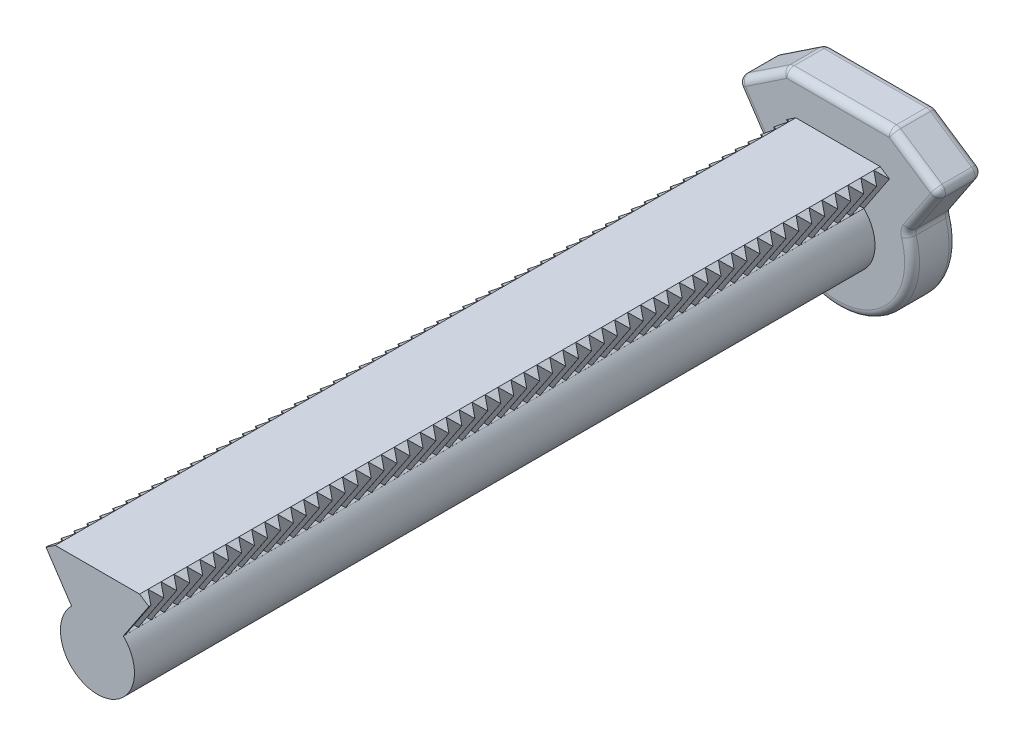
from build123d import *
from OCP.BRepFilletAPI import BRepFilletAPI_MakeChamfer

# Parameters (mm, degrees)
SALIENTE_EXTRUIR1_DEPTH = 100
CHAFL_N2_SIZE           = 1
CHAFL_N2_SIZE2          = 1.800819464
CORTAR_EXTRUIR1_DEPTH   = 6.2
MATRIZL1_COUNT          = 57
MATRIZL1_PITCH          = 1.75
SIMETR_A1_COPY_1_DEPTH  = 6.2
SIMETR_A1_COPY_2_DEPTH  = 6.2
SIMETR_A1_COPY_3_DEPTH  = 6.2
SIMETR_A1_COPY_4_DEPTH  = 6.2
SIMETR_A1_COPY_5_DEPTH  = 6.2
SIMETR_A1_COPY_6_DEPTH  = 6.2
SIMETR_A1_COPY_7_DEPTH  = 6.2
SIMETR_A1_COPY_8_DEPTH  = 6.2
SIMETR_A1_COPY_9_DEPTH  = 6.2
SIMETR_A1_COPY_10_DEPTH = 6.2
SIMETR_A1_COPY_11_DEPTH = 6.2
SIMETR_A1_COPY_12_DEPTH = 6.2
SIMETR_A1_COPY_13_DEPTH = 6.2
SIMETR_A1_COPY_14_DEPTH = 6.2
SIMETR_A1_COPY_15_DEPTH = 6.2
SIMETR_A1_COPY_16_DEPTH = 6.2
SIMETR_A1_COPY_17_DEPTH = 6.2
SIMETR_A1_COPY_18_DEPTH = 6.2
SIMETR_A1_COPY_19_DEPTH = 6.2
SIMETR_A1_COPY_20_DEPTH = 6.2
SIMETR_A1_COPY_21_DEPTH = 6.2
SIMETR_A1_COPY_22_DEPTH = 6.2
SIMETR_A1_COPY_23_DEPTH = 6.2
SIMETR_A1_COPY_24_DEPTH = 6.2
SIMETR_A1_COPY_25_DEPTH = 6.2
SIMETR_A1_COPY_26_DEPTH = 6.2
SIMETR_A1_COPY_27_DEPTH = 6.2
SIMETR_A1_COPY_28_DEPTH = 6.2
SIMETR_A1_COPY_29_DEPTH = 6.2
SIMETR_A1_COPY_30_DEPTH = 6.2
SIMETR_A1_COPY_31_DEPTH = 6.2
SIMETR_A1_COPY_32_DEPTH = 6.2
SIMETR_A1_COPY_33_DEPTH = 6.2
SIMETR_A1_COPY_34_DEPTH = 6.2
SIMETR_A1_COPY_35_DEPTH = 6.2
SIMETR_A1_COPY_36_DEPTH = 6.2
SIMETR_A1_COPY_37_DEPTH = 6.2
SIMETR_A1_COPY_38_DEPTH = 6.2
SIMETR_A1_COPY_39_DEPTH = 6.2
SIMETR_A1_COPY_40_DEPTH = 6.2
SIMETR_A1_COPY_41_DEPTH = 6.2
SIMETR_A1_COPY_42_DEPTH = 6.2
SIMETR_A1_COPY_43_DEPTH = 6.2
SIMETR_A1_COPY_44_DEPTH = 6.2
SIMETR_A1_COPY_45_DEPTH = 6.2
SIMETR_A1_COPY_46_DEPTH = 6.2
SIMETR_A1_COPY_47_DEPTH = 6.2
SIMETR_A1_COPY_48_DEPTH = 6.2
SIMETR_A1_COPY_49_DEPTH = 6.2
SIMETR_A1_COPY_50_DEPTH = 6.2
SIMETR_A1_COPY_51_DEPTH = 6.2
SIMETR_A1_COPY_52_DEPTH = 6.2
SIMETR_A1_COPY_53_DEPTH = 6.2
SIMETR_A1_COPY_54_DEPTH = 6.2
SIMETR_A1_COPY_55_DEPTH = 6.2
SIMETR_A1_COPY_56_DEPTH = 6.2
SIMETR_A1_COPY_57_DEPTH = 6.2
SALIENTE_EXTRUIR2_DEPTH = 6
REDONDEO1_R             = 1


with BuildPart() as part:
    # Croquis1 → Saliente-Extruir1 (new body)
    with BuildSketch(Plane.XY):
        with BuildLine():
            Line((-7.5, 9.576859786), (-3.493719232, 3.576859786))
            ThreePointArc((-3.493719232, 3.576859786), (0, -5), (3.493719232, 3.576859786))
            Line((3.493719232, 3.576859786), (7.5, 9.576859786))
            Line((7.5, 9.576859786), (-7.5, 9.576859786))
        make_face()
    extrude(amount=SALIENTE_EXTRUIR1_DEPTH)

    # Chaflán2: one chamfer whose edges measure the first distance from different faces: ONE call of the kernel's chamfer builder (chamfer() names one face for all edges)
    chafl_n2_edges_1 = [part.edges().sort_by_distance(p)[0] for p in [
        (-7.5, 9.576859786, 50),
    ]]
    chafl_n2_side_1 = [part.faces().sort_by_distance(p)[0] for p in [
        (-5.496859616, 6.576859786, 50),
    ]]
    chafl_n2_edges_2 = [part.edges().sort_by_distance(p)[0] for p in [
        (7.5, 9.576859786, 50),
    ]]
    chafl_n2_side_2 = [part.faces().sort_by_distance(p)[0] for p in [
        (5.496859616, 6.576859786, 50),
    ]]
    chafl_n2 = BRepFilletAPI_MakeChamfer(part.part.solid().wrapped)
    for e in chafl_n2_edges_1:
        chafl_n2.Add(CHAFL_N2_SIZE, CHAFL_N2_SIZE2, e.wrapped, chafl_n2_side_1[0].wrapped)  # the first distance lies on this face
    for e in chafl_n2_edges_2:
        chafl_n2.Add(CHAFL_N2_SIZE, CHAFL_N2_SIZE2, e.wrapped, chafl_n2_side_2[0].wrapped)  # the first distance lies on this face
    add(Compound.cast(chafl_n2.Shape()), mode=Mode.REPLACE)

    # Croquis2 → Cortar-Extruir1 (cut)
    with BuildSketch(Plane(origin=(6.180158411, 9.255704384, 0), x_dir=(0.8316482768383068, -0.555302749526666, 0), z_dir=(0.555302749526666, 0.8316482768383068, 0))):
        Polygon((0.919305505, 0), (0.919305505, -1.729335419), (-0.578342899, -0.864667709), align=None)
    cortar_extruir1 = extrude(amount=-CORTAR_EXTRUIR1_DEPTH, mode=Mode.SUBTRACT)

    # MatrizL1: Cortar-Extruir1 ×57
    with Locations(*[(0, 0, i * MATRIZL1_PITCH) for i in range(1, MATRIZL1_COUNT)]):
        add(cortar_extruir1, mode=Mode.SUBTRACT)

    # Simetría1 copy 1 sketch → Simetría1 copy 1 (cut)
    with BuildSketch(Plane(origin=(-6.180158411, 9.255704384, 1.75), x_dir=(-0.8316482768383068, -0.555302749526666, 0), z_dir=(-0.555302749526666, 0.8316482768383068, 0))):
        Polygon((0.919305505, 0), (0.919305505, 1.729335419), (-0.578342899, 0.864667709), align=None)
    extrude(amount=-SIMETR_A1_COPY_1_DEPTH, mode=Mode.SUBTRACT)

    # Simetría1 copy 2 sketch → Simetría1 copy 2 (cut)
    with BuildSketch(Plane(origin=(-6.180158411, 9.255704384, 3.5), x_dir=(-0.8316482768383068, -0.555302749526666, 0), z_dir=(-0.555302749526666, 0.8316482768383068, 0))):
        Polygon((0.919305505, 0), (0.919305505, 1.729335419), (-0.578342899, 0.864667709), align=None)
    extrude(amount=-SIMETR_A1_COPY_2_DEPTH, mode=Mode.SUBTRACT)

    # Simetría1 copy 3 sketch → Simetría1 copy 3 (cut)
    with BuildSketch(Plane(origin=(-6.180158411, 9.255704384, 5.25), x_dir=(-0.8316482768383068, -0.555302749526666, 0), z_dir=(-0.555302749526666, 0.8316482768383068, 0))):
        Polygon((0.919305505, 0), (0.919305505, 1.729335419), (-0.578342899, 0.864667709), align=None)
    extrude(amount=-SIMETR_A1_COPY_3_DEPTH, mode=Mode.SUBTRACT)

    # Simetría1 copy 4 sketch → Simetría1 copy 4 (cut)
    with BuildSketch(Plane(origin=(-6.180158411, 9.255704384, 7), x_dir=(-0.8316482768383068, -0.555302749526666, 0), z_dir=(-0.555302749526666, 0.8316482768383068, 0))):
        Polygon((0.919305505, 0), (0.919305505, 1.729335419), (-0.578342899, 0.864667709), align=None)
    extrude(amount=-SIMETR_A1_COPY_4_DEPTH, mode=Mode.SUBTRACT)

    # Simetría1 copy 5 sketch → Simetría1 copy 5 (cut)
    with BuildSketch(Plane(origin=(-6.180158411, 9.255704384, 8.75), x_dir=(-0.8316482768383068, -0.555302749526666, 0), z_dir=(-0.555302749526666, 0.8316482768383068, 0))):
        Polygon((0.919305505, 0), (0.919305505, 1.729335419), (-0.578342899, 0.864667709), align=None)
    extrude(amount=-SIMETR_A1_COPY_5_DEPTH, mode=Mode.SUBTRACT)

    # Simetría1 copy 6 sketch → Simetría1 copy 6 (cut)
    with BuildSketch(Plane(origin=(-6.180158411, 9.255704384, 10.5), x_dir=(-0.8316482768383068, -0.555302749526666, 0), z_dir=(-0.555302749526666, 0.8316482768383068, 0))):
        Polygon((0.919305505, 0), (0.919305505, 1.729335419), (-0.578342899, 0.864667709), align=None)
    extrude(amount=-SIMETR_A1_COPY_6_DEPTH, mode=Mode.SUBTRACT)

    # Simetría1 copy 7 sketch → Simetría1 copy 7 (cut)
    with BuildSketch(Plane(origin=(-6.180158411, 9.255704384, 12.25), x_dir=(-0.8316482768383068, -0.555302749526666, 0), z_dir=(-0.555302749526666, 0.8316482768383068, 0))):
        Polygon((0.919305505, 0), (0.919305505, 1.729335419), (-0.578342899, 0.864667709), align=None)
    extrude(amount=-SIMETR_A1_COPY_7_DEPTH, mode=Mode.SUBTRACT)

    # Simetría1 copy 8 sketch → Simetría1 copy 8 (cut)
    with BuildSketch(Plane(origin=(-6.180158411, 9.255704384, 14), x_dir=(-0.8316482768383068, -0.555302749526666, 0), z_dir=(-0.555302749526666, 0.8316482768383068, 0))):
        Polygon((0.919305505, 0), (0.919305505, 1.729335419), (-0.578342899, 0.864667709), align=None)
    extrude(amount=-SIMETR_A1_COPY_8_DEPTH, mode=Mode.SUBTRACT)

    # Simetría1 copy 9 sketch → Simetría1 copy 9 (cut)
    with BuildSketch(Plane(origin=(-6.180158411, 9.255704384, 15.75), x_dir=(-0.8316482768383068, -0.555302749526666, 0), z_dir=(-0.555302749526666, 0.8316482768383068, 0))):
        Polygon((0.919305505, 0), (0.919305505, 1.729335419), (-0.578342899, 0.864667709), align=None)
    extrude(amount=-SIMETR_A1_COPY_9_DEPTH, mode=Mode.SUBTRACT)

    # Simetría1 copy 10 sketch → Simetría1 copy 10 (cut)
    with BuildSketch(Plane(origin=(-6.180158411, 9.255704384, 17.5), x_dir=(-0.8316482768383068, -0.555302749526666, 0), z_dir=(-0.555302749526666, 0.8316482768383068, 0))):
        Polygon((0.919305505, 0), (0.919305505, 1.729335419), (-0.578342899, 0.864667709), align=None)
    extrude(amount=-SIMETR_A1_COPY_10_DEPTH, mode=Mode.SUBTRACT)

    # Simetría1 copy 11 sketch → Simetría1 copy 11 (cut)
    with BuildSketch(Plane(origin=(-6.180158411, 9.255704384, 19.25), x_dir=(-0.8316482768383068, -0.555302749526666, 0), z_dir=(-0.555302749526666, 0.8316482768383068, 0))):
        Polygon((0.919305505, 0), (0.919305505, 1.729335419), (-0.578342899, 0.864667709), align=None)
    extrude(amount=-SIMETR_A1_COPY_11_DEPTH, mode=Mode.SUBTRACT)

    # Simetría1 copy 12 sketch → Simetría1 copy 12 (cut)
    with BuildSketch(Plane(origin=(-6.180158411, 9.255704384, 21), x_dir=(-0.8316482768383068, -0.555302749526666, 0), z_dir=(-0.555302749526666, 0.8316482768383068, 0))):
        Polygon((0.919305505, 0), (0.919305505, 1.729335419), (-0.578342899, 0.864667709), align=None)
    extrude(amount=-SIMETR_A1_COPY_12_DEPTH, mode=Mode.SUBTRACT)

    # Simetría1 copy 13 sketch → Simetría1 copy 13 (cut)
    with BuildSketch(Plane(origin=(-6.180158411, 9.255704384, 22.75), x_dir=(-0.8316482768383068, -0.555302749526666, 0), z_dir=(-0.555302749526666, 0.8316482768383068, 0))):
        Polygon((0.919305505, 0), (0.919305505, 1.729335419), (-0.578342899, 0.864667709), align=None)
    extrude(amount=-SIMETR_A1_COPY_13_DEPTH, mode=Mode.SUBTRACT)

    # Simetría1 copy 14 sketch → Simetría1 copy 14 (cut)
    with BuildSketch(Plane(origin=(-6.180158411, 9.255704384, 24.5), x_dir=(-0.8316482768383068, -0.555302749526666, 0), z_dir=(-0.555302749526666, 0.8316482768383068, 0))):
        Polygon((0.919305505, 0), (0.919305505, 1.729335419), (-0.578342899, 0.864667709), align=None)
    extrude(amount=-SIMETR_A1_COPY_14_DEPTH, mode=Mode.SUBTRACT)

    # Simetría1 copy 15 sketch → Simetría1 copy 15 (cut)
    with BuildSketch(Plane(origin=(-6.180158411, 9.255704384, 26.25), x_dir=(-0.8316482768383068, -0.555302749526666, 0), z_dir=(-0.555302749526666, 0.8316482768383068, 0))):
        Polygon((0.919305505, 0), (0.919305505, 1.729335419), (-0.578342899, 0.864667709), align=None)
    extrude(amount=-SIMETR_A1_COPY_15_DEPTH, mode=Mode.SUBTRACT)

    # Simetría1 copy 16 sketch → Simetría1 copy 16 (cut)
    with BuildSketch(Plane(origin=(-6.180158411, 9.255704384, 28), x_dir=(-0.8316482768383068, -0.555302749526666, 0), z_dir=(-0.555302749526666, 0.8316482768383068, 0))):
        Polygon((0.919305505, 0), (0.919305505, 1.729335419), (-0.578342899, 0.864667709), align=None)
    extrude(amount=-SIMETR_A1_COPY_16_DEPTH, mode=Mode.SUBTRACT)

    # Simetría1 copy 17 sketch → Simetría1 copy 17 (cut)
    with BuildSketch(Plane(origin=(-6.180158411, 9.255704384, 29.75), x_dir=(-0.8316482768383068, -0.555302749526666, 0), z_dir=(-0.555302749526666, 0.8316482768383068, 0))):
        Polygon((0.919305505, 0), (0.919305505, 1.729335419), (-0.578342899, 0.864667709), align=None)
    extrude(amount=-SIMETR_A1_COPY_17_DEPTH, mode=Mode.SUBTRACT)

    # Simetría1 copy 18 sketch → Simetría1 copy 18 (cut)
    with BuildSketch(Plane(origin=(-6.180158411, 9.255704384, 31.5), x_dir=(-0.8316482768383068, -0.555302749526666, 0), z_dir=(-0.555302749526666, 0.8316482768383068, 0))):
        Polygon((0.919305505, 0), (0.919305505, 1.729335419), (-0.578342899, 0.864667709), align=None)
    extrude(amount=-SIMETR_A1_COPY_18_DEPTH, mode=Mode.SUBTRACT)

    # Simetría1 copy 19 sketch → Simetría1 copy 19 (cut)
    with BuildSketch(Plane(origin=(-6.180158411, 9.255704384, 33.25), x_dir=(-0.8316482768383068, -0.555302749526666, 0), z_dir=(-0.555302749526666, 0.8316482768383068, 0))):
        Polygon((0.919305505, 0), (0.919305505, 1.729335419), (-0.578342899, 0.864667709), align=None)
    extrude(amount=-SIMETR_A1_COPY_19_DEPTH, mode=Mode.SUBTRACT)

    # Simetría1 copy 20 sketch → Simetría1 copy 20 (cut)
    with BuildSketch(Plane(origin=(-6.180158411, 9.255704384, 35), x_dir=(-0.8316482768383068, -0.555302749526666, 0), z_dir=(-0.555302749526666, 0.8316482768383068, 0))):
        Polygon((0.919305505, 0), (0.919305505, 1.729335419), (-0.578342899, 0.864667709), align=None)
    extrude(amount=-SIMETR_A1_COPY_20_DEPTH, mode=Mode.SUBTRACT)

    # Simetría1 copy 21 sketch → Simetría1 copy 21 (cut)
    with BuildSketch(Plane(origin=(-6.180158411, 9.255704384, 36.75), x_dir=(-0.8316482768383068, -0.555302749526666, 0), z_dir=(-0.555302749526666, 0.8316482768383068, 0))):
        Polygon((0.919305505, 0), (0.919305505, 1.729335419), (-0.578342899, 0.864667709), align=None)
    extrude(amount=-SIMETR_A1_COPY_21_DEPTH, mode=Mode.SUBTRACT)

    # Simetría1 copy 22 sketch → Simetría1 copy 22 (cut)
    with BuildSketch(Plane(origin=(-6.180158411, 9.255704384, 38.5), x_dir=(-0.8316482768383068, -0.555302749526666, 0), z_dir=(-0.555302749526666, 0.8316482768383068, 0))):
        Polygon((0.919305505, 0), (0.919305505, 1.729335419), (-0.578342899, 0.864667709), align=None)
    extrude(amount=-SIMETR_A1_COPY_22_DEPTH, mode=Mode.SUBTRACT)

    # Simetría1 copy 23 sketch → Simetría1 copy 23 (cut)
    with BuildSketch(Plane(origin=(-6.180158411, 9.255704384, 40.25), x_dir=(-0.8316482768383068, -0.555302749526666, 0), z_dir=(-0.555302749526666, 0.8316482768383068, 0))):
        Polygon((0.919305505, 0), (0.919305505, 1.729335419), (-0.578342899, 0.864667709), align=None)
    extrude(amount=-SIMETR_A1_COPY_23_DEPTH, mode=Mode.SUBTRACT)

    # Simetría1 copy 24 sketch → Simetría1 copy 24 (cut)
    with BuildSketch(Plane(origin=(-6.180158411, 9.255704384, 42), x_dir=(-0.8316482768383068, -0.555302749526666, 0), z_dir=(-0.555302749526666, 0.8316482768383068, 0))):
        Polygon((0.919305505, 0), (0.919305505, 1.729335419), (-0.578342899, 0.864667709), align=None)
    extrude(amount=-SIMETR_A1_COPY_24_DEPTH, mode=Mode.SUBTRACT)

    # Simetría1 copy 25 sketch → Simetría1 copy 25 (cut)
    with BuildSketch(Plane(origin=(-6.180158411, 9.255704384, 43.75), x_dir=(-0.8316482768383068, -0.555302749526666, 0), z_dir=(-0.555302749526666, 0.8316482768383068, 0))):
        Polygon((0.919305505, 0), (0.919305505, 1.729335419), (-0.578342899, 0.864667709), align=None)
    extrude(amount=-SIMETR_A1_COPY_25_DEPTH, mode=Mode.SUBTRACT)

    # Simetría1 copy 26 sketch → Simetría1 copy 26 (cut)
    with BuildSketch(Plane(origin=(-6.180158411, 9.255704384, 45.5), x_dir=(-0.8316482768383068, -0.555302749526666, 0), z_dir=(-0.555302749526666, 0.8316482768383068, 0))):
        Polygon((0.919305505, 0), (0.919305505, 1.729335419), (-0.578342899, 0.864667709), align=None)
    extrude(amount=-SIMETR_A1_COPY_26_DEPTH, mode=Mode.SUBTRACT)

    # Simetría1 copy 27 sketch → Simetría1 copy 27 (cut)
    with BuildSketch(Plane(origin=(-6.180158411, 9.255704384, 47.25), x_dir=(-0.8316482768383068, -0.555302749526666, 0), z_dir=(-0.555302749526666, 0.8316482768383068, 0))):
        Polygon((0.919305505, 0), (0.919305505, 1.729335419), (-0.578342899, 0.864667709), align=None)
    extrude(amount=-SIMETR_A1_COPY_27_DEPTH, mode=Mode.SUBTRACT)

    # Simetría1 copy 28 sketch → Simetría1 copy 28 (cut)
    with BuildSketch(Plane(origin=(-6.180158411, 9.255704384, 49), x_dir=(-0.8316482768383068, -0.555302749526666, 0), z_dir=(-0.555302749526666, 0.8316482768383068, 0))):
        Polygon((0.919305505, 0), (0.919305505, 1.729335419), (-0.578342899, 0.864667709), align=None)
    extrude(amount=-SIMETR_A1_COPY_28_DEPTH, mode=Mode.SUBTRACT)

    # Simetría1 copy 29 sketch → Simetría1 copy 29 (cut)
    with BuildSketch(Plane(origin=(-6.180158411, 9.255704384, 50.75), x_dir=(-0.8316482768383068, -0.555302749526666, 0), z_dir=(-0.555302749526666, 0.8316482768383068, 0))):
        Polygon((0.919305505, 0), (0.919305505, 1.729335419), (-0.578342899, 0.864667709), align=None)
    extrude(amount=-SIMETR_A1_COPY_29_DEPTH, mode=Mode.SUBTRACT)

    # Simetría1 copy 30 sketch → Simetría1 copy 30 (cut)
    with BuildSketch(Plane(origin=(-6.180158411, 9.255704384, 52.5), x_dir=(-0.8316482768383068, -0.555302749526666, 0), z_dir=(-0.555302749526666, 0.8316482768383068, 0))):
        Polygon((0.919305505, 0), (0.919305505, 1.729335419), (-0.578342899, 0.864667709), align=None)
    extrude(amount=-SIMETR_A1_COPY_30_DEPTH, mode=Mode.SUBTRACT)

    # Simetría1 copy 31 sketch → Simetría1 copy 31 (cut)
    with BuildSketch(Plane(origin=(-6.180158411, 9.255704384, 54.25), x_dir=(-0.8316482768383068, -0.555302749526666, 0), z_dir=(-0.555302749526666, 0.8316482768383068, 0))):
        Polygon((0.919305505, 0), (0.919305505, 1.729335419), (-0.578342899, 0.864667709), align=None)
    extrude(amount=-SIMETR_A1_COPY_31_DEPTH, mode=Mode.SUBTRACT)

    # Simetría1 copy 32 sketch → Simetría1 copy 32 (cut)
    with BuildSketch(Plane(origin=(-6.180158411, 9.255704384, 56), x_dir=(-0.8316482768383068, -0.555302749526666, 0), z_dir=(-0.555302749526666, 0.8316482768383068, 0))):
        Polygon((0.919305505, 0), (0.919305505, 1.729335419), (-0.578342899, 0.864667709), align=None)
    extrude(amount=-SIMETR_A1_COPY_32_DEPTH, mode=Mode.SUBTRACT)

    # Simetría1 copy 33 sketch → Simetría1 copy 33 (cut)
    with BuildSketch(Plane(origin=(-6.180158411, 9.255704384, 57.75), x_dir=(-0.8316482768383068, -0.555302749526666, 0), z_dir=(-0.555302749526666, 0.8316482768383068, 0))):
        Polygon((0.919305505, 0), (0.919305505, 1.729335419), (-0.578342899, 0.864667709), align=None)
    extrude(amount=-SIMETR_A1_COPY_33_DEPTH, mode=Mode.SUBTRACT)

    # Simetría1 copy 34 sketch → Simetría1 copy 34 (cut)
    with BuildSketch(Plane(origin=(-6.180158411, 9.255704384, 59.5), x_dir=(-0.8316482768383068, -0.555302749526666, 0), z_dir=(-0.555302749526666, 0.8316482768383068, 0))):
        Polygon((0.919305505, 0), (0.919305505, 1.729335419), (-0.578342899, 0.864667709), align=None)
    extrude(amount=-SIMETR_A1_COPY_34_DEPTH, mode=Mode.SUBTRACT)

    # Simetría1 copy 35 sketch → Simetría1 copy 35 (cut)
    with BuildSketch(Plane(origin=(-6.180158411, 9.255704384, 61.25), x_dir=(-0.8316482768383068, -0.555302749526666, 0), z_dir=(-0.555302749526666, 0.8316482768383068, 0))):
        Polygon((0.919305505, 0), (0.919305505, 1.729335419), (-0.578342899, 0.864667709), align=None)
    extrude(amount=-SIMETR_A1_COPY_35_DEPTH, mode=Mode.SUBTRACT)

    # Simetría1 copy 36 sketch → Simetría1 copy 36 (cut)
    with BuildSketch(Plane(origin=(-6.180158411, 9.255704384, 63), x_dir=(-0.8316482768383068, -0.555302749526666, 0), z_dir=(-0.555302749526666, 0.8316482768383068, 0))):
        Polygon((0.919305505, 0), (0.919305505, 1.729335419), (-0.578342899, 0.864667709), align=None)
    extrude(amount=-SIMETR_A1_COPY_36_DEPTH, mode=Mode.SUBTRACT)

    # Simetría1 copy 37 sketch → Simetría1 copy 37 (cut)
    with BuildSketch(Plane(origin=(-6.180158411, 9.255704384, 64.75), x_dir=(-0.8316482768383068, -0.555302749526666, 0), z_dir=(-0.555302749526666, 0.8316482768383068, 0))):
        Polygon((0.919305505, 0), (0.919305505, 1.729335419), (-0.578342899, 0.864667709), align=None)
    extrude(amount=-SIMETR_A1_COPY_37_DEPTH, mode=Mode.SUBTRACT)

    # Simetría1 copy 38 sketch → Simetría1 copy 38 (cut)
    with BuildSketch(Plane(origin=(-6.180158411, 9.255704384, 66.5), x_dir=(-0.8316482768383068, -0.555302749526666, 0), z_dir=(-0.555302749526666, 0.8316482768383068, 0))):
        Polygon((0.919305505, 0), (0.919305505, 1.729335419), (-0.578342899, 0.864667709), align=None)
    extrude(amount=-SIMETR_A1_COPY_38_DEPTH, mode=Mode.SUBTRACT)

    # Simetría1 copy 39 sketch → Simetría1 copy 39 (cut)
    with BuildSketch(Plane(origin=(-6.180158411, 9.255704384, 68.25), x_dir=(-0.8316482768383068, -0.555302749526666, 0), z_dir=(-0.555302749526666, 0.8316482768383068, 0))):
        Polygon((0.919305505, 0), (0.919305505, 1.729335419), (-0.578342899, 0.864667709), align=None)
    extrude(amount=-SIMETR_A1_COPY_39_DEPTH, mode=Mode.SUBTRACT)

    # Simetría1 copy 40 sketch → Simetría1 copy 40 (cut)
    with BuildSketch(Plane(origin=(-6.180158411, 9.255704384, 70), x_dir=(-0.8316482768383068, -0.555302749526666, 0), z_dir=(-0.555302749526666, 0.8316482768383068, 0))):
        Polygon((0.919305505, 0), (0.919305505, 1.729335419), (-0.578342899, 0.864667709), align=None)
    extrude(amount=-SIMETR_A1_COPY_40_DEPTH, mode=Mode.SUBTRACT)

    # Simetría1 copy 41 sketch → Simetría1 copy 41 (cut)
    with BuildSketch(Plane(origin=(-6.180158411, 9.255704384, 71.75), x_dir=(-0.8316482768383068, -0.555302749526666, 0), z_dir=(-0.555302749526666, 0.8316482768383068, 0))):
        Polygon((0.919305505, 0), (0.919305505, 1.729335419), (-0.578342899, 0.864667709), align=None)
    extrude(amount=-SIMETR_A1_COPY_41_DEPTH, mode=Mode.SUBTRACT)

    # Simetría1 copy 42 sketch → Simetría1 copy 42 (cut)
    with BuildSketch(Plane(origin=(-6.180158411, 9.255704384, 73.5), x_dir=(-0.8316482768383068, -0.555302749526666, 0), z_dir=(-0.555302749526666, 0.8316482768383068, 0))):
        Polygon((0.919305505, 0), (0.919305505, 1.729335419), (-0.578342899, 0.864667709), align=None)
    extrude(amount=-SIMETR_A1_COPY_42_DEPTH, mode=Mode.SUBTRACT)

    # Simetría1 copy 43 sketch → Simetría1 copy 43 (cut)
    with BuildSketch(Plane(origin=(-6.180158411, 9.255704384, 75.25), x_dir=(-0.8316482768383068, -0.555302749526666, 0), z_dir=(-0.555302749526666, 0.8316482768383068, 0))):
        Polygon((0.919305505, 0), (0.919305505, 1.729335419), (-0.578342899, 0.864667709), align=None)
    extrude(amount=-SIMETR_A1_COPY_43_DEPTH, mode=Mode.SUBTRACT)

    # Simetría1 copy 44 sketch → Simetría1 copy 44 (cut)
    with BuildSketch(Plane(origin=(-6.180158411, 9.255704384, 77), x_dir=(-0.8316482768383068, -0.555302749526666, 0), z_dir=(-0.555302749526666, 0.8316482768383068, 0))):
        Polygon((0.919305505, 0), (0.919305505, 1.729335419), (-0.578342899, 0.864667709), align=None)
    extrude(amount=-SIMETR_A1_COPY_44_DEPTH, mode=Mode.SUBTRACT)

    # Simetría1 copy 45 sketch → Simetría1 copy 45 (cut)
    with BuildSketch(Plane(origin=(-6.180158411, 9.255704384, 78.75), x_dir=(-0.8316482768383068, -0.555302749526666, 0), z_dir=(-0.555302749526666, 0.8316482768383068, 0))):
        Polygon((0.919305505, 0), (0.919305505, 1.729335419), (-0.578342899, 0.864667709), align=None)
    extrude(amount=-SIMETR_A1_COPY_45_DEPTH, mode=Mode.SUBTRACT)

    # Simetría1 copy 46 sketch → Simetría1 copy 46 (cut)
    with BuildSketch(Plane(origin=(-6.180158411, 9.255704384, 80.5), x_dir=(-0.8316482768383068, -0.555302749526666, 0), z_dir=(-0.555302749526666, 0.8316482768383068, 0))):
        Polygon((0.919305505, 0), (0.919305505, 1.729335419), (-0.578342899, 0.864667709), align=None)
    extrude(amount=-SIMETR_A1_COPY_46_DEPTH, mode=Mode.SUBTRACT)

    # Simetría1 copy 47 sketch → Simetría1 copy 47 (cut)
    with BuildSketch(Plane(origin=(-6.180158411, 9.255704384, 82.25), x_dir=(-0.8316482768383068, -0.555302749526666, 0), z_dir=(-0.555302749526666, 0.8316482768383068, 0))):
        Polygon((0.919305505, 0), (0.919305505, 1.729335419), (-0.578342899, 0.864667709), align=None)
    extrude(amount=-SIMETR_A1_COPY_47_DEPTH, mode=Mode.SUBTRACT)

    # Simetría1 copy 48 sketch → Simetría1 copy 48 (cut)
    with BuildSketch(Plane(origin=(-6.180158411, 9.255704384, 84), x_dir=(-0.8316482768383068, -0.555302749526666, 0), z_dir=(-0.555302749526666, 0.8316482768383068, 0))):
        Polygon((0.919305505, 0), (0.919305505, 1.729335419), (-0.578342899, 0.864667709), align=None)
    extrude(amount=-SIMETR_A1_COPY_48_DEPTH, mode=Mode.SUBTRACT)

    # Simetría1 copy 49 sketch → Simetría1 copy 49 (cut)
    with BuildSketch(Plane(origin=(-6.180158411, 9.255704384, 85.75), x_dir=(-0.8316482768383068, -0.555302749526666, 0), z_dir=(-0.555302749526666, 0.8316482768383068, 0))):
        Polygon((0.919305505, 0), (0.919305505, 1.729335419), (-0.578342899, 0.864667709), align=None)
    extrude(amount=-SIMETR_A1_COPY_49_DEPTH, mode=Mode.SUBTRACT)

    # Simetría1 copy 50 sketch → Simetría1 copy 50 (cut)
    with BuildSketch(Plane(origin=(-6.180158411, 9.255704384, 87.5), x_dir=(-0.8316482768383068, -0.555302749526666, 0), z_dir=(-0.555302749526666, 0.8316482768383068, 0))):
        Polygon((0.919305505, 0), (0.919305505, 1.729335419), (-0.578342899, 0.864667709), align=None)
    extrude(amount=-SIMETR_A1_COPY_50_DEPTH, mode=Mode.SUBTRACT)

    # Simetría1 copy 51 sketch → Simetría1 copy 51 (cut)
    with BuildSketch(Plane(origin=(-6.180158411, 9.255704384, 89.25), x_dir=(-0.8316482768383068, -0.555302749526666, 0), z_dir=(-0.555302749526666, 0.8316482768383068, 0))):
        Polygon((0.919305505, 0), (0.919305505, 1.729335419), (-0.578342899, 0.864667709), align=None)
    extrude(amount=-SIMETR_A1_COPY_51_DEPTH, mode=Mode.SUBTRACT)

    # Simetría1 copy 52 sketch → Simetría1 copy 52 (cut)
    with BuildSketch(Plane(origin=(-6.180158411, 9.255704384, 91), x_dir=(-0.8316482768383068, -0.555302749526666, 0), z_dir=(-0.555302749526666, 0.8316482768383068, 0))):
        Polygon((0.919305505, 0), (0.919305505, 1.729335419), (-0.578342899, 0.864667709), align=None)
    extrude(amount=-SIMETR_A1_COPY_52_DEPTH, mode=Mode.SUBTRACT)

    # Simetría1 copy 53 sketch → Simetría1 copy 53 (cut)
    with BuildSketch(Plane(origin=(-6.180158411, 9.255704384, 92.75), x_dir=(-0.8316482768383068, -0.555302749526666, 0), z_dir=(-0.555302749526666, 0.8316482768383068, 0))):
        Polygon((0.919305505, 0), (0.919305505, 1.729335419), (-0.578342899, 0.864667709), align=None)
    extrude(amount=-SIMETR_A1_COPY_53_DEPTH, mode=Mode.SUBTRACT)

    # Simetría1 copy 54 sketch → Simetría1 copy 54 (cut)
    with BuildSketch(Plane(origin=(-6.180158411, 9.255704384, 94.5), x_dir=(-0.8316482768383068, -0.555302749526666, 0), z_dir=(-0.555302749526666, 0.8316482768383068, 0))):
        Polygon((0.919305505, 0), (0.919305505, 1.729335419), (-0.578342899, 0.864667709), align=None)
    extrude(amount=-SIMETR_A1_COPY_54_DEPTH, mode=Mode.SUBTRACT)

    # Simetría1 copy 55 sketch → Simetría1 copy 55 (cut)
    with BuildSketch(Plane(origin=(-6.180158411, 9.255704384, 96.25), x_dir=(-0.8316482768383068, -0.555302749526666, 0), z_dir=(-0.555302749526666, 0.8316482768383068, 0))):
        Polygon((0.919305505, 0), (0.919305505, 1.729335419), (-0.578342899, 0.864667709), align=None)
    extrude(amount=-SIMETR_A1_COPY_55_DEPTH, mode=Mode.SUBTRACT)

    # Simetría1 copy 56 sketch → Simetría1 copy 56 (cut)
    with BuildSketch(Plane(origin=(-6.180158411, 9.255704384, 98), x_dir=(-0.8316482768383068, -0.555302749526666, 0), z_dir=(-0.555302749526666, 0.8316482768383068, 0))):
        Polygon((0.919305505, 0), (0.919305505, 1.729335419), (-0.578342899, 0.864667709), align=None)
    extrude(amount=-SIMETR_A1_COPY_56_DEPTH, mode=Mode.SUBTRACT)

    # Simetría1 copy 57 sketch → Simetría1 copy 57 (cut)
    with BuildSketch(Plane(origin=(-6.180158411, 9.255704384, 0), x_dir=(-0.8316482768383068, -0.555302749526666, 0), z_dir=(-0.555302749526666, 0.8316482768383068, 0))):
        Polygon((0.919305505, 0), (0.919305505, 1.729335419), (-0.578342899, 0.864667709), align=None)
    extrude(amount=-SIMETR_A1_COPY_57_DEPTH, mode=Mode.SUBTRACT)

    # Croquis3 → Saliente-Extruir2 (add)
    with BuildSketch(Plane(origin=(0, 0, 0), x_dir=(-1, 0, 0), z_dir=(0, 0, -1))):
        with BuildLine():
            Line((9.398459147, 3.415986777), (13.879452382, 10.126939146))
            Line((13.879452382, 10.126939146), (7.215035835, 14.576859786))
            Line((7.215035835, 14.576859786), (-7.215035835, 14.576859786))
            Line((-7.215035835, 14.576859786), (-13.879452382, 10.126939146))
            Line((-13.879452382, 10.126939146), (-9.398459147, 3.415986777))
            ThreePointArc((-9.398459147, 3.415986777), (0, -10), (9.398459147, 3.415986777))
        make_face()
    extrude(amount=SALIENTE_EXTRUIR2_DEPTH)

    # Redondeo1
    redondeo1_edges = [part.edges().sort_by_distance(p)[0] for p in [
        (0, -10, 0),
        (-9.398459147, 3.415986777, -3),
        (-11.638955765, 6.771462961, 0),
        (9.398459147, 3.415986777, -3),
        (11.638955765, 6.771462961, 0),
        (13.879452382, 10.126939146, -3),
        (10.547244109, 12.351899466, 0),
        (-13.879452382, 10.126939146, -3),
        (-10.547244109, 12.351899466, 0),
        (-7.215035835, 14.576859786, -3),
        (7.215035835, 14.576859786, -3),
        (0, 14.576859786, 0),
        (11.638955765, 6.771462961, -6),
        (10.547244109, 12.351899466, -6),
        (0, 14.576859786, -6),
        (-10.547244109, 12.351899466, -6),
        (-11.638955765, 6.771462961, -6),
        (0, -10, -6),
    ]]
    fillet(redondeo1_edges, radius=REDONDEO1_R)


solid = part.part
